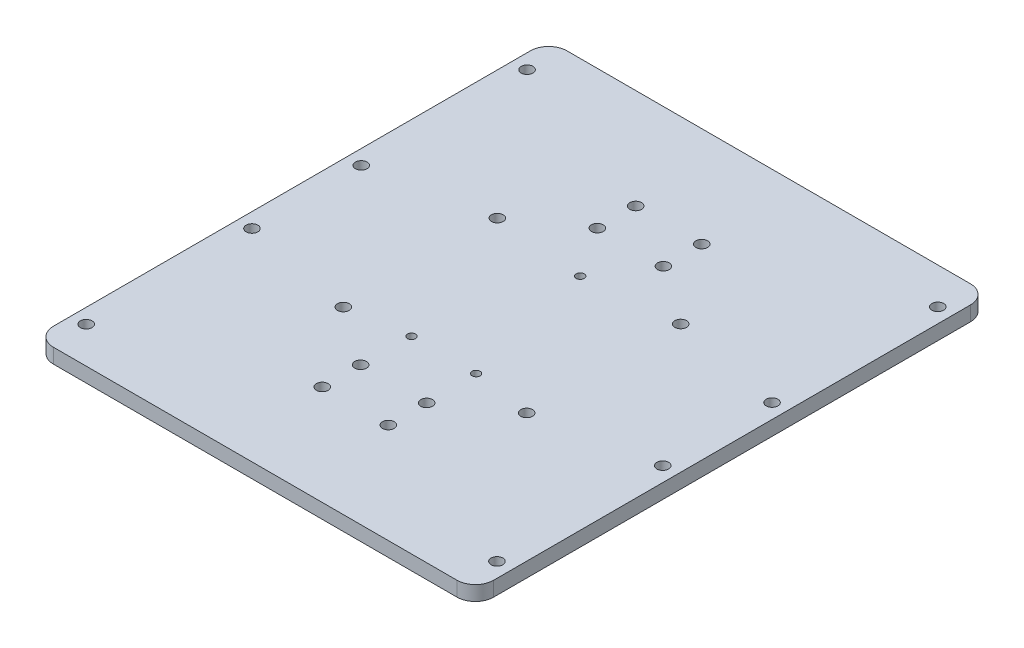
from build123d import *

# Parameters (mm, degrees)
SKETCH_1_W      = 120
SKETCH_1_H      = 140
SKETCH_1_R      = 1.6
SKETCH_1_R_2    = 1.1
EXTRUDE_1_DEPTH = 4
FILLET_1_R      = 5


with BuildPart() as part:
    # 草图1 → 凸台-拉伸1 (new body)
    with BuildSketch(Plane(origin=(0, 0, 0), x_dir=(1, 0, 0), z_dir=(0, 1, 0))):
        Rectangle(SKETCH_1_W, SKETCH_1_H)
        with Locations((-56, 60.1)):
            Circle(SKETCH_1_R, mode=Mode.SUBTRACT)
        with Locations((-56, 14.9)):
            Circle(SKETCH_1_R, mode=Mode.SUBTRACT)
        with Locations((-9, 42.73)):
            Circle(SKETCH_1_R, mode=Mode.SUBTRACT)
        with Locations((-9, 32.27)):
            Circle(SKETCH_1_R, mode=Mode.SUBTRACT)
        with Locations((-56, -14.9)):
            Circle(SKETCH_1_R, mode=Mode.SUBTRACT)
        with Locations((-9, -32.27)):
            Circle(SKETCH_1_R, mode=Mode.SUBTRACT)
        with Locations((-9, -42.73)):
            Circle(SKETCH_1_R, mode=Mode.SUBTRACT)
        with Locations((-56, -60.1)):
            Circle(SKETCH_1_R, mode=Mode.SUBTRACT)
        with Locations((56, -60.1)):
            Circle(SKETCH_1_R, mode=Mode.SUBTRACT)
        with Locations((9, -42.73)):
            Circle(SKETCH_1_R, mode=Mode.SUBTRACT)
        with Locations((9, -32.27)):
            Circle(SKETCH_1_R, mode=Mode.SUBTRACT)
        with Locations((56, -14.9)):
            Circle(SKETCH_1_R, mode=Mode.SUBTRACT)
        with Locations((56, 14.9)):
            Circle(SKETCH_1_R, mode=Mode.SUBTRACT)
        with Locations((9, 32.27)):
            Circle(SKETCH_1_R, mode=Mode.SUBTRACT)
        with Locations((9, 42.73)):
            Circle(SKETCH_1_R, mode=Mode.SUBTRACT)
        with Locations((56, 60.1)):
            Circle(SKETCH_1_R, mode=Mode.SUBTRACT)
        with Locations((0, 18.6)):
            Circle(SKETCH_1_R_2, mode=Mode.SUBTRACT)
        with Locations((8.8, -18.6)):
            Circle(SKETCH_1_R_2, mode=Mode.SUBTRACT)
        with Locations((-8.8, -18.6)):
            Circle(SKETCH_1_R_2, mode=Mode.SUBTRACT)
        with Locations((-25, 21)):
            Circle(SKETCH_1_R, mode=Mode.SUBTRACT)
        with Locations((25, 21)):
            Circle(SKETCH_1_R, mode=Mode.SUBTRACT)
        with Locations((25, -21)):
            Circle(SKETCH_1_R, mode=Mode.SUBTRACT)
        with Locations((-25, -21)):
            Circle(SKETCH_1_R, mode=Mode.SUBTRACT)
    extrude(amount=EXTRUDE_1_DEPTH)

    # 圆角1
    fillet_1_edges = [part.edges().sort_by_distance(p)[0] for p in [
        (-60, 2, -70),
        (60, 2, -70),
        (60, 2, 70),
        (-60, 2, 70),
    ]]
    fillet(fillet_1_edges, radius=FILLET_1_R)


solid = part.part
